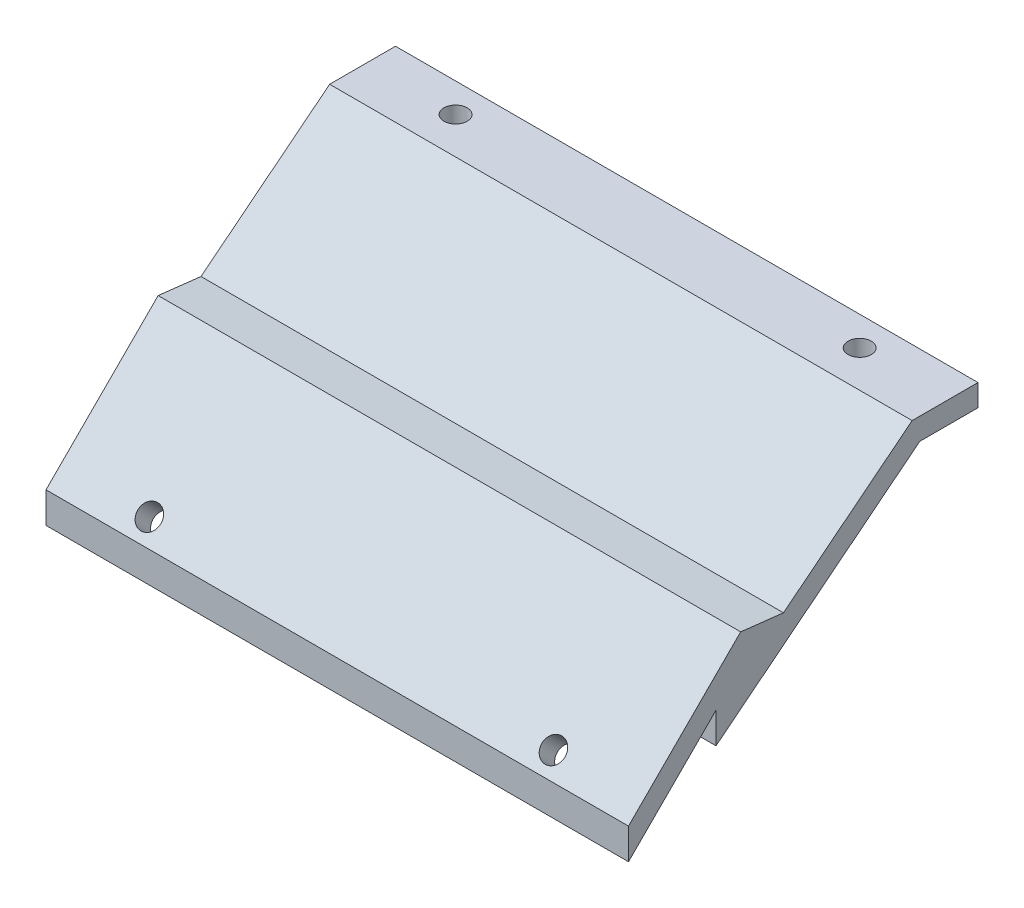
from build123d import *

# Parameters (mm, degrees)
BOSS_EXTRUDE1_DEPTH = 40
SKETCH2_R           = 1.6
CUT_EXTRUDE1_DEPTH  = 3
SKETCH3_W           = 80
SKETCH3_H           = 3
BOSS_EXTRUDE2_DEPTH = 8
SKETCH4_W           = 80
SKETCH4_H           = 0.830903327
CUT_EXTRUDE2_DEPTH  = 64.839370972
CHAMFER1_SIZE       = 5.693972562
CHAMFER1_SIZE_2     = 8
SKETCH5_R           = 1.6
CUT_EXTRUDE3_DEPTH  = 3


with BuildPart() as part:
    # Sketch1 → Boss-Extrude1 (new, symmetric)
    with BuildSketch(Plane(origin=(0, 0, 0), x_dir=(0, 0, -1), z_dir=(1, 0, 0))):
        Polygon((0, 0), (0, -4.242640687), (12.02081528, 7.778174593), (12.02081528, 3.538174593), (40, 25.757359313), (40, 29.58826264), (15.02081528, 9.751475936), (15.02081528, 15.02081528), align=None)
    extrude(amount=BOSS_EXTRUDE1_DEPTH, both=True)

    # Sketch2 → Cut-Extrude1 (cut)
    with BuildSketch(Plane(origin=(0, -2.121320344, -2.121320344), x_dir=(1, 0, 0), z_dir=(0, -0.7071067811865513, -0.7071067811865438))):
        with Locations(Location((-27.75, -2.75, 0), (0, 0, 270))):
            Circle(SKETCH2_R)
        with Locations(Location((27.75, -2.75, 0), (0, 0, 270))):
            Circle(SKETCH2_R)
    extrude(amount=-CUT_EXTRUDE1_DEPTH, mode=Mode.SUBTRACT)

    # Sketch3 → Boss-Extrude2 (add)
    with BuildSketch(Plane(origin=(0, 0, -40), x_dir=(-1, 0, 0), z_dir=(0, 0, -1))):
        with Locations((0, 27.257359313)):
            Rectangle(SKETCH3_W, SKETCH3_H)
    extrude(amount=BOSS_EXTRUDE2_DEPTH)

    # Sketch4 → Cut-Extrude2 (cut, through all)
    with BuildSketch(Plane(origin=(0, 0, -40), x_dir=(-1, 0, 0), z_dir=(0, 0, -1))):
        with Locations((0, 29.172810977)):
            Rectangle(SKETCH4_W, SKETCH4_H)
    extrude(amount=-CUT_EXTRUDE2_DEPTH, mode=Mode.SUBTRACT)

    # Chamfer1
    # the kernel refuses this chamfer: 8, 5.693972562 mm, written as the material it adds along each edge
    with BuildSketch(Plane(origin=(40, 9.751475936, -15.02081528), x_dir=(0, 0.9984646393058687, 0.05539281592229428), z_dir=(-1, 0, 0))) as chamfer1_piece_1_section:
        Polygon((CHAMFER1_SIZE * 0.998464639351, CHAMFER1_SIZE * 0.0553928159248), (CHAMFER1_SIZE_2 * 0.577556137161, CHAMFER1_SIZE_2 * 0.816350971352), (0, 0), align=None)
    chamfer1_piece_1 = extrude(amount=80, mode=Mode.PRIVATE)
    chamfer1_piece_1 = split(chamfer1_piece_1, bisect_by=Plane(origin=(0, 15.189171508, -15.189171508), z_dir=(0, -0.7071067811865511, -0.7071067811865441)), keep=Keep.TOP, mode=Mode.PRIVATE)
    add(chamfer1_piece_1)

    # Sketch5 → Cut-Extrude3 (cut)
    with BuildSketch(Plane.XZ.offset(-25.757359313)):
        with Locations(Location((-27.75, -44, 0), (0, 0, 270))):
            Circle(SKETCH5_R)
        with Locations(Location((27.75, -44, 0), (0, 0, 270))):
            Circle(SKETCH5_R)
    extrude(amount=-CUT_EXTRUDE3_DEPTH, mode=Mode.SUBTRACT)


solid = part.part
